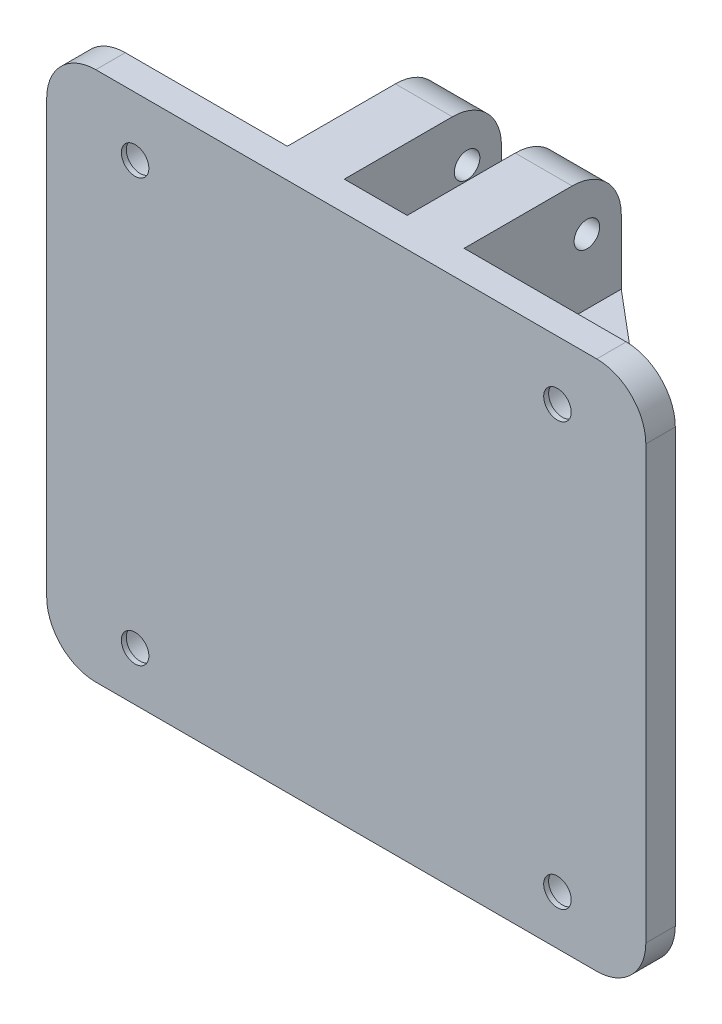
from build123d import *

# Parameters (mm, degrees)
F_61_START                              = 18
F_61_X_61_RADAR_PLATFORM_DEPTH          = 3
C1_START                                = 17.9
C1_FOUR_CLEARANCES_43_X_43_MM_PROFILE_R = 1.4
C1_FOUR_CLEARANCES_43_X_43_MM_DEPTH     = 5.2
C1_SCREW_HEAD_POCKETS_PROFILE_R         = 2.55
C1_SCREW_HEAD_POCKETS_DEPTH             = 2.6
SKETCH_3_W                              = 5.8
SKETCH_3_H                              = 61
EXTRUDE_2_DEPTH                         = 16
SKETCH_4_R                              = 1.3
CUT_EXTRUDE_4_DEPTH                     = 25
SKETCH_5_W                              = 16
SKETCH_5_H                              = 17.8
EXTRUDE_3_DEPTH                         = 19
SKETCH_6_W                              = 19
SKETCH_6_H                              = 17.8
EXTRUDE_4_DEPTH                         = 16
CUT_EXTRUDE_5_DEPTH                     = 25.9
FILLET_4_R                              = 7
SKETCH_8_W                              = 61.060792307
SKETCH_8_H                              = 7.060792307
CUT_EXTRUDE_6_DEPTH                     = 25.9
FILLET_5_R                              = 5


with BuildPart() as part:
    # 61 x 61 radar platform profile → 61 x 61 radar platform (new body)
    with BuildSketch(Plane.XY.offset(F_61_START)):
        with BuildLine():
            Line((31.5, 47.5), (82.5, 47.5))
            ThreePointArc((82.5, 47.5), (86.035533906, 48.964466094), (87.5, 52.5))
            Line((87.5, 52.5), (87.5, 103.5))
            ThreePointArc((87.5, 103.5), (86.035533906, 107.035533906), (82.5, 108.5))
            Line((82.5, 108.5), (31.5, 108.5))
            ThreePointArc((31.5, 108.5), (27.964466094, 107.035533906), (26.5, 103.5))
            Line((26.5, 103.5), (26.5, 52.5))
            ThreePointArc((26.5, 52.5), (27.964466094, 48.964466094), (31.5, 47.5))
        make_face()
    extrude(amount=F_61_X_61_RADAR_PLATFORM_DEPTH)

    # C1 four clearances 43 x 43 mm profile → C1 four clearances 43 x 43 mm (cut)
    with BuildSketch(Plane.XY.offset(C1_START)):
        with Locations((35.5, 59.5)):
            Circle(C1_FOUR_CLEARANCES_43_X_43_MM_PROFILE_R)
        with Locations((35.5, 102.5)):
            Circle(C1_FOUR_CLEARANCES_43_X_43_MM_PROFILE_R)
        with Locations((78.5, 59.5)):
            Circle(C1_FOUR_CLEARANCES_43_X_43_MM_PROFILE_R)
        with Locations((78.5, 102.5)):
            Circle(C1_FOUR_CLEARANCES_43_X_43_MM_PROFILE_R)
    extrude(amount=C1_FOUR_CLEARANCES_43_X_43_MM_DEPTH, mode=Mode.SUBTRACT)

    # C1 screw head pockets profile → C1 screw head pockets (cut)
    with BuildSketch(Plane.XY.offset(C1_START)):
        with Locations((35.5, 59.5)):
            Circle(C1_SCREW_HEAD_POCKETS_PROFILE_R)
        with Locations((35.5, 102.5)):
            Circle(C1_SCREW_HEAD_POCKETS_PROFILE_R)
        with Locations((78.5, 59.5)):
            Circle(C1_SCREW_HEAD_POCKETS_PROFILE_R)
        with Locations((78.5, 102.5)):
            Circle(C1_SCREW_HEAD_POCKETS_PROFILE_R)
    extrude(amount=C1_SCREW_HEAD_POCKETS_DEPTH, mode=Mode.SUBTRACT)

    # 草图3 → 凸台-拉伸2 (add)
    with BuildSketch(Plane(origin=(0, 0, 18), x_dir=(-1, 0, 0), z_dir=(0, 0, -1))):
        with Locations((-63.1, 78)):
            Rectangle(SKETCH_3_W, SKETCH_3_H)
        with Locations((-50.9, 78)):
            Rectangle(SKETCH_3_W, SKETCH_3_H)
    extrude(amount=EXTRUDE_2_DEPTH)

    # 草图4 → 切除-拉伸4 (cut)
    with BuildSketch(Plane(origin=(66, 0, 0), x_dir=(0, 0, -1), z_dir=(1, 0, 0))):
        with Locations(Location((-15.5, 103.5, 0), (0, 0, 90))):
            Circle(SKETCH_4_R)
        with Locations(Location((-15.5, 74.5, 0), (0, 0, 90))):
            Circle(SKETCH_4_R)
        with Locations(Location((-5.5, 103.5, 0), (0, 0, 90))):
            Circle(SKETCH_4_R)
        with Locations(Location((-5.5, 74.5, 0), (0, 0, 90))):
            Circle(SKETCH_4_R)
    extrude(amount=-CUT_EXTRUDE_4_DEPTH, mode=Mode.SUBTRACT)

    # 草图5 → 凸台-拉伸3 (add)
    with BuildSketch(Plane(origin=(66, 0, 0), x_dir=(0, 0, -1), z_dir=(1, 0, 0))):
        with Locations((-10, 88)):
            Rectangle(SKETCH_5_W, SKETCH_5_H)
    extrude(amount=EXTRUDE_3_DEPTH)

    # 草图6 → 凸台-拉伸4 (add)
    with BuildSketch(Plane(origin=(0, 0, 18), x_dir=(-1, 0, 0), z_dir=(0, 0, -1))):
        with Locations((-38.5, 88)):
            Rectangle(SKETCH_6_W, SKETCH_6_H)
    extrude(amount=EXTRUDE_4_DEPTH)

    # 草图7 → 切除-拉伸5 (cut)
    with BuildSketch(Plane(origin=(0, 96.9, 0), x_dir=(1, 0, 0), z_dir=(0, 1, 0))):
        Polygon((66, -2), (85, -2), (85, -18), align=None)
        Polygon((48, -2), (29, -2), (29, -18), align=None)
    extrude(amount=-CUT_EXTRUDE_5_DEPTH, mode=Mode.SUBTRACT)

    # 圆角4
    # the kernel refuses this fillet: 7 mm, written as the material it adds along each edge
    with BuildSketch(Plane(origin=(85, 79.1, 18), x_dir=(-0.7649111981170483, 0, -0.6441357457827827), z_dir=(0, 1, 0))) as fillet_4_piece_1_section:
        with BuildLine():
            CenterArc((FILLET_4_R * 0.364967793547, -FILLET_4_R), FILLET_4_R, 90, 40.100907546)
            Line((-FILLET_4_R * 0.279167952236, -FILLET_4_R * 0.235088801883), (0, 0))
            Line((0, 0), (FILLET_4_R * 0.364967793547, 0))
        make_face()
    fillet_4_piece_1 = extrude(amount=17.8, mode=Mode.PRIVATE)
    fillet_4_piece_1 = split(fillet_4_piece_1, bisect_by=Plane(origin=(87.5, 88, 17.657135978), z_dir=(-1, 0, 0)), keep=Keep.TOP, mode=Mode.PRIVATE)
    add(fillet_4_piece_1)
    with BuildSketch(Plane(origin=(29, 96.9, 18), x_dir=(-1, 0, 0), z_dir=(0, -1, 0))) as fillet_4_piece_2_section:
        with BuildLine():
            CenterArc((FILLET_4_R * 0.364967793547, FILLET_4_R), FILLET_4_R, 229.899092454, 40.100907546)
            Line((-FILLET_4_R * 0.279167952236, FILLET_4_R * 0.235088801883), (0, 0))
            Line((0, 0), (FILLET_4_R * 0.364967793547, 0))
        make_face()
    fillet_4_piece_2 = extrude(amount=17.8, mode=Mode.PRIVATE)
    fillet_4_piece_2 = split(fillet_4_piece_2, bisect_by=Plane(origin=(26.5, 88, 17.657135978), z_dir=(1, 0, 0)), keep=Keep.TOP, mode=Mode.PRIVATE)
    add(fillet_4_piece_2)

    # 草图8 → 切除-拉伸6 (cut)
    with BuildSketch(Plane.XY.offset(21)):
        with Locations((57.030396153, 50.969603847)):
            Rectangle(SKETCH_8_W, SKETCH_8_H)
    extrude(amount=-CUT_EXTRUDE_6_DEPTH, mode=Mode.SUBTRACT)

    # 圆角5
    fillet_5_edges = [part.edges().sort_by_distance(p)[0] for p in [
        (63.1, 54.5, 2),
        (26.5, 54.5, 19.5),
        (87.5, 54.5, 19.5),
        (50.9, 54.5, 2),
        (63.1, 108.5, 2),
        (50.9, 108.5, 2),
    ]]
    fillet(fillet_5_edges, radius=FILLET_5_R)


solid = part.part
